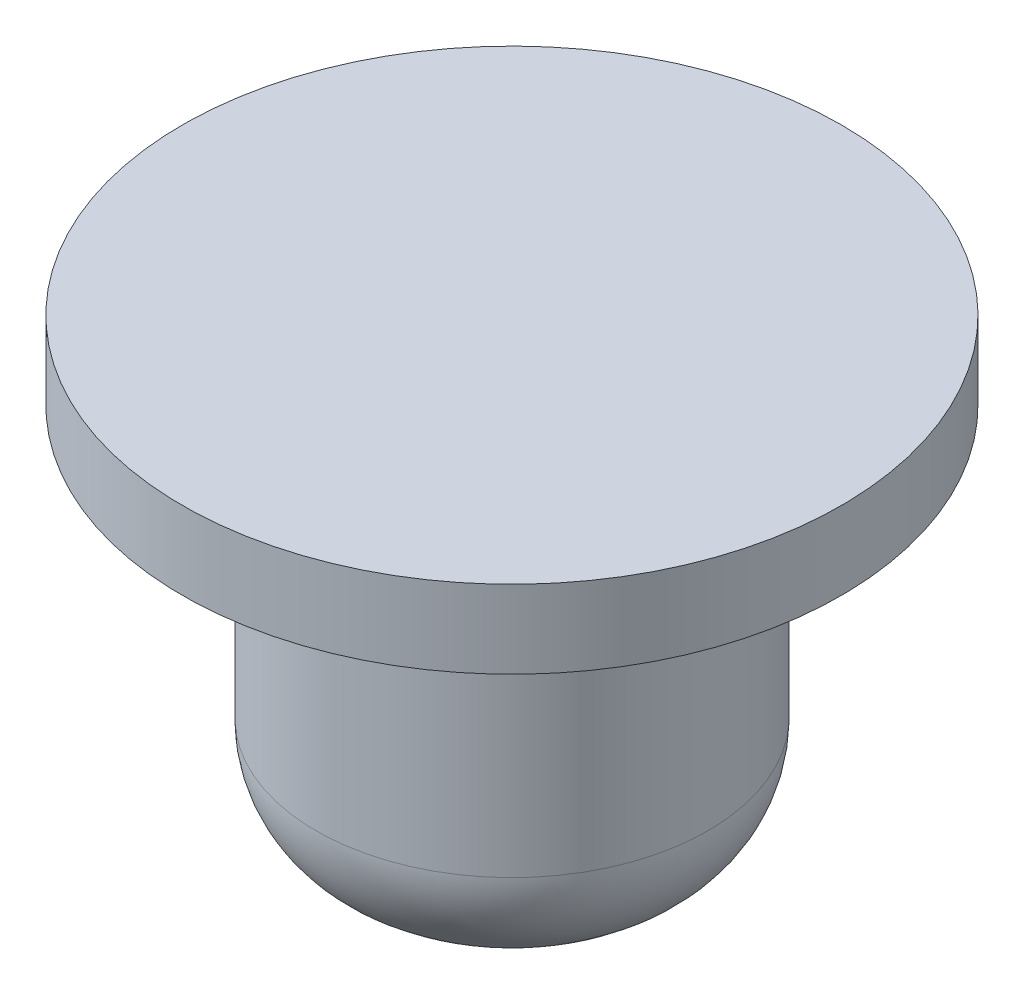
from build123d import *


with BuildPart() as part:
    # Sketch1 → Revolve1 (revolve)
    with BuildSketch(Plane.XY):
        with BuildLine():
            Line((0, 7.552481474), (10.679586151, 7.552481474))
            Line((10.679586151, 7.552481474), (10.679586151, 5.027354561))
            Line((10.679586151, 5.027354561), (6.35, 5.027354561))
            Line((6.35, 5.027354561), (6.35, -3.742481474))
            ThreePointArc((6.35, -3.742481474), (5.234076836, -6.43655831), (2.54, -7.552481474))
            Line((2.54, -7.552481474), (0, -7.552481474))
            Line((0, -7.552481474), (0, 7.552481474))
        make_face()
    revolve(axis=Axis((0, -7.552481474, 0), (0, 1, 0)))


solid = part.part
